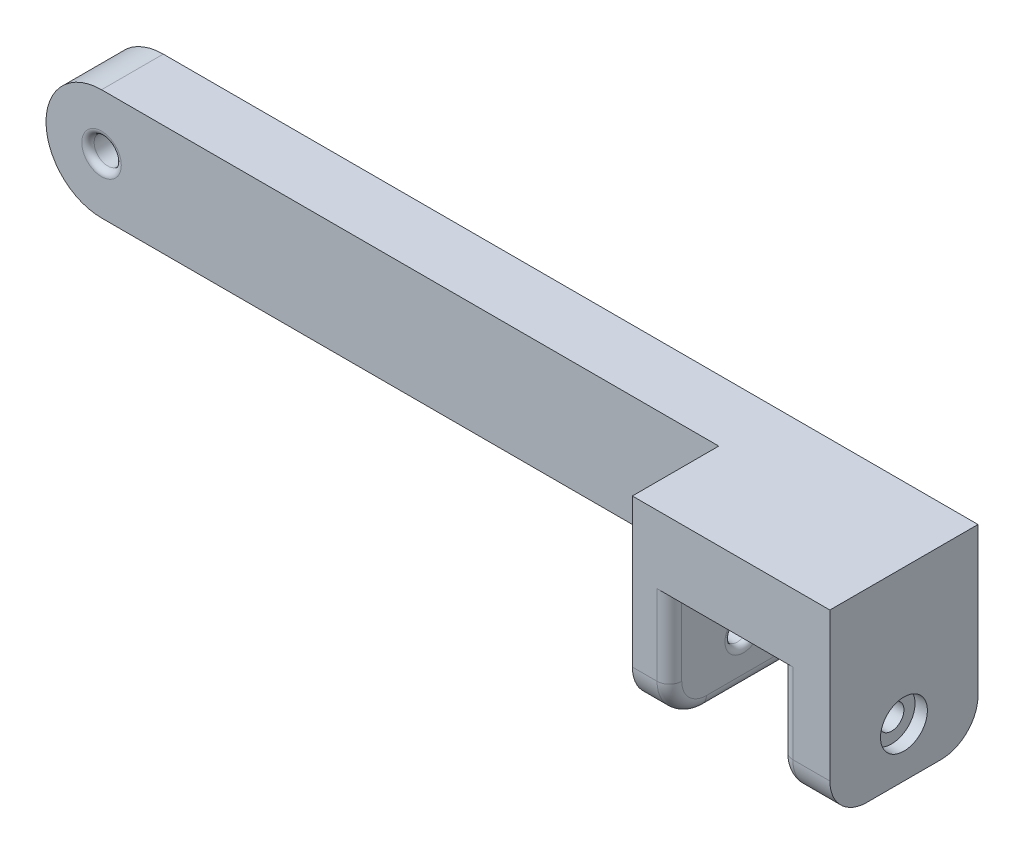
from build123d import *

# Parameters (mm, degrees)
SKETCH1_R           = 1.1
BOSS_EXTRUDE1_DEPTH = 5
SKETCH2_W           = 16
SKETCH2_H           = 12
BOSS_EXTRUDE2_DEPTH = 15
CUT_EXTRUDE1_START  = -5.5
SKETCH3_W           = 9
SKETCH3_H           = 15.5
CUT_EXTRUDE1_DEPTH  = 9.5
SKETCH4_R           = 1
CUT_EXTRUDE2_DEPTH  = 16
FILLET2_R           = 0.5
SKETCH5_R           = 1.9
CUT_EXTRUDE3_DEPTH  = 1
FILLET3_R           = 1
CUT_EXTRUDE4_START  = -0.5
SKETCH6_R           = 2
CUT_EXTRUDE4_DEPTH  = 5.5
FILLET4_R           = 3
FILLET5_R           = 0.5


with BuildPart() as part:
    # Sketch1 → Boss-Extrude1 (new body)
    with BuildSketch(Plane.XY):
        with BuildLine():
            ThreePointArc((0, 4.5), (-4.5, 0), (0, -4.5))
            Line((0, -4.5), (50, -4.5))
            Line((50, -4.5), (50, 4.5))
            Line((50, 4.5), (0, 4.5))
        make_face()
        Circle(SKETCH1_R, mode=Mode.SUBTRACT)
    extrude(amount=BOSS_EXTRUDE1_DEPTH)

    # Sketch2 → Boss-Extrude2 (add)
    with BuildSketch(Plane(origin=(0, 4.5, 0), x_dir=(1, 0, 0), z_dir=(0, 1, 0))):
        with Locations((58, -6)):
            Rectangle(SKETCH2_W, SKETCH2_H)
    extrude(amount=-BOSS_EXTRUDE2_DEPTH)

    # Sketch3 → Cut-Extrude1 (cut)
    with BuildSketch(Plane(origin=(0, 4.5, 0), x_dir=(1, 0, 0), z_dir=(0, 1, 0)).offset(CUT_EXTRUDE1_START)):
        with Locations((57.5, -4.25)):
            Rectangle(SKETCH3_W, SKETCH3_H)
    extrude(amount=-CUT_EXTRUDE1_DEPTH, mode=Mode.SUBTRACT)

    # Sketch4 → Cut-Extrude2 (cut)
    with BuildSketch(Plane(origin=(66, 0, 0), x_dir=(0, 0, -1), z_dir=(1, 0, 0))):
        with Locations((-6, -6.5)):
            Circle(SKETCH4_R)
    extrude(amount=-CUT_EXTRUDE2_DEPTH, mode=Mode.SUBTRACT)

    # Fillet2
    fillet2_edges = [part.edges().sort_by_distance(p)[0] for p in [
        (53, -6.5, 7),
    ]]
    fillet(fillet2_edges, radius=FILLET2_R)

    # Sketch5 → Cut-Extrude3 (cut)
    with BuildSketch(Plane(origin=(66, 0, 0), x_dir=(0, 0, -1), z_dir=(1, 0, 0))):
        with Locations((-6, -6.5)):
            Circle(SKETCH5_R)
    extrude(amount=-CUT_EXTRUDE3_DEPTH, mode=Mode.SUBTRACT)

    # Fillet3
    fillet3_edges = [part.edges().sort_by_distance(p)[0] for p in [
        (53, -10.5, 6),
        (62, -10.5, 6),
        (62, -5.75, 0),
        (53, -5.75, 0),
        (53, -5.75, 12),
        (62, -5.75, 12),
    ]]
    fillet(fillet3_edges, radius=FILLET3_R)

    # Sketch6 → Cut-Extrude4 (cut)
    with BuildSketch(Plane.ZY.offset(-50).offset(CUT_EXTRUDE4_START)):
        with Locations((6, -6.5)):
            Circle(SKETCH6_R)
    extrude(amount=CUT_EXTRUDE4_DEPTH, mode=Mode.SUBTRACT)

    # Fillet4
    # the kernel refuses this fillet: 3 mm, written as the material it takes off along each edge
    with BuildSketch(Plane(origin=(53, -7.5, 3), x_dir=(0, -1, 0), z_dir=(0, 0, 1))) as fillet4_piece_1:
        with BuildLine():
            CenterArc((2, -1), 1, 0, 90)
            Line((3, -1), (3, 0))
            Line((3, 0), (2, 0))
        make_face()
    revolve(axis=Axis((53, -7.5, 3), (1, 0, 0)), revolution_arc=90, mode=Mode.SUBTRACT)
    with BuildSketch(Plane(origin=(53, -7.5, 9), x_dir=(0, 0, 1), z_dir=(0, 1, 0))) as fillet4_piece_2:
        with BuildLine():
            CenterArc((2, -1), 1, 0, 90)
            Line((3, -1), (3, 0))
            Line((3, 0), (2, 0))
        make_face()
    revolve(axis=Axis((53, -7.5, 9), (1, 0, 0)), revolution_arc=90, mode=Mode.SUBTRACT)
    with BuildSketch(Plane(origin=(62, -7.5, 9), x_dir=(0, -1, 0), z_dir=(0, 0, -1))) as fillet4_piece_3:
        with BuildLine():
            CenterArc((2, -1), 1, 0, 90)
            Line((3, -1), (3, 0))
            Line((3, 0), (2, 0))
        make_face()
    revolve(axis=Axis((62, -7.5, 9), (-1, 0, 0)), revolution_arc=90, mode=Mode.SUBTRACT)
    with BuildSketch(Plane(origin=(62, -7.5, 3), x_dir=(0, 0, -1), z_dir=(0, 1, 0))) as fillet4_piece_4:
        with BuildLine():
            CenterArc((2, -1), 1, 0, 90)
            Line((3, -1), (3, 0))
            Line((3, 0), (2, 0))
        make_face()
    revolve(axis=Axis((62, -7.5, 3), (-1, 0, 0)), revolution_arc=90, mode=Mode.SUBTRACT)
    with BuildSketch(Plane(origin=(62, -10.5, 0), x_dir=(0, 1, 0), z_dir=(1, 0, 0)), Plane(origin=(73.5, -10.5, 12), x_dir=(0, 1, 0), z_dir=(-1, 0, 0))) as fillet4_piece_5:
        with BuildLine():
            CenterArc((FILLET4_R, FILLET4_R), FILLET4_R, 180, 90)
            Line((0, FILLET4_R), (0, 0))
            Line((0, 0), (FILLET4_R, 0))
        make_face()
    extrude(amount=11.5, mode=Mode.SUBTRACT)
    with BuildSketch(Plane(origin=(53, -10.5, 12), x_dir=(0, 1, 0), z_dir=(-1, 0, 0)), Plane(origin=(42.5, -10.5, 0), x_dir=(0, 1, 0), z_dir=(1, 0, 0))) as fillet4_piece_6:
        with BuildLine():
            CenterArc((FILLET4_R, FILLET4_R), FILLET4_R, 180, 90)
            Line((0, FILLET4_R), (0, 0))
            Line((0, 0), (FILLET4_R, 0))
        make_face()
    extrude(amount=10.5, mode=Mode.SUBTRACT)

    # Fillet5
    fillet5_edges = [part.edges().sort_by_distance(p)[0] for p in [
        (-1.1, 0, 5),
        (-1.1, 0, 0),
    ]]
    fillet(fillet5_edges, radius=FILLET5_R)


solid = part.part
